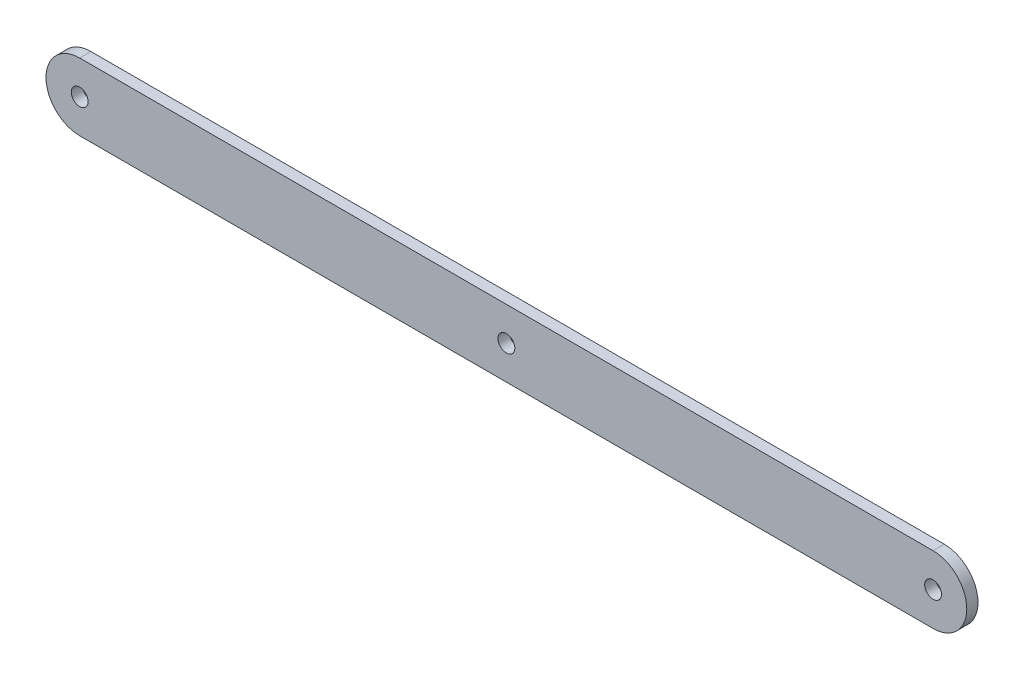
from build123d import *

# Parameters (mm, degrees)
SKETCH1_R           = 1.5
BOSS_EXTRUDE1_DEPTH = 2


with BuildPart() as part:
    # Sketch1 → Boss-Extrude1 (new body)
    with BuildSketch(Plane.XY):
        with BuildLine():
            Line((-76, 6), (76, 6))
            ThreePointArc((76, 6), (82, 0), (76, -6))
            Line((76, -6), (-76, -6))
            ThreePointArc((-76, -6), (-82, 0), (-76, 6))
        make_face()
        with Locations((-76, 0)):
            Circle(SKETCH1_R, mode=Mode.SUBTRACT)
        Circle(SKETCH1_R, mode=Mode.SUBTRACT)
        with Locations((76, 0)):
            Circle(SKETCH1_R, mode=Mode.SUBTRACT)
    extrude(amount=BOSS_EXTRUDE1_DEPTH)


solid = part.part
